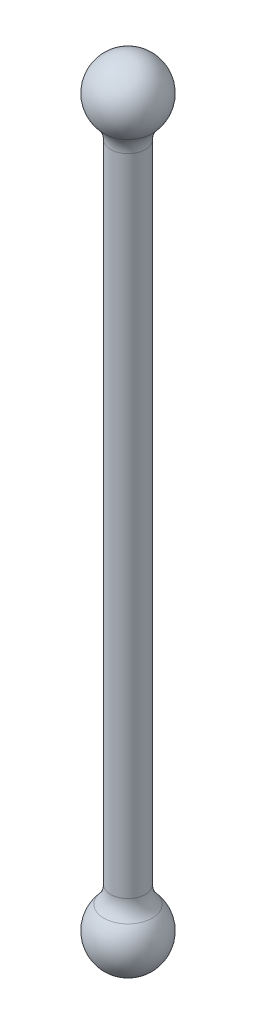
from build123d import *


with BuildPart() as part:
    # Sketch1 → Revolve1 (revolve)
    with BuildSketch(Plane.XY):
        with BuildLine():
            Line((0, 6.75), (0, -73.25))
            Line((0, -73.25), (3.5, -73.25))
            Line((3.5, -73.25), (3.5, -8.11249037))
            ThreePointArc((3.5, -8.11249037), (3.858604392, -6.253069275), (4.882978723, -4.660366808))
            ThreePointArc((4.882978723, -4.660366808), (6.205641625, 2.655656609), (0, 6.75))
        make_face()
    revolve1 = revolve(axis=Axis((0, 6.75, 0), (0, -1, 0)))

    # Mirror1: Revolve1 across plane
    add(revolve1.mirror(Plane.ZX.offset(-73.25)))


solid = part.part
